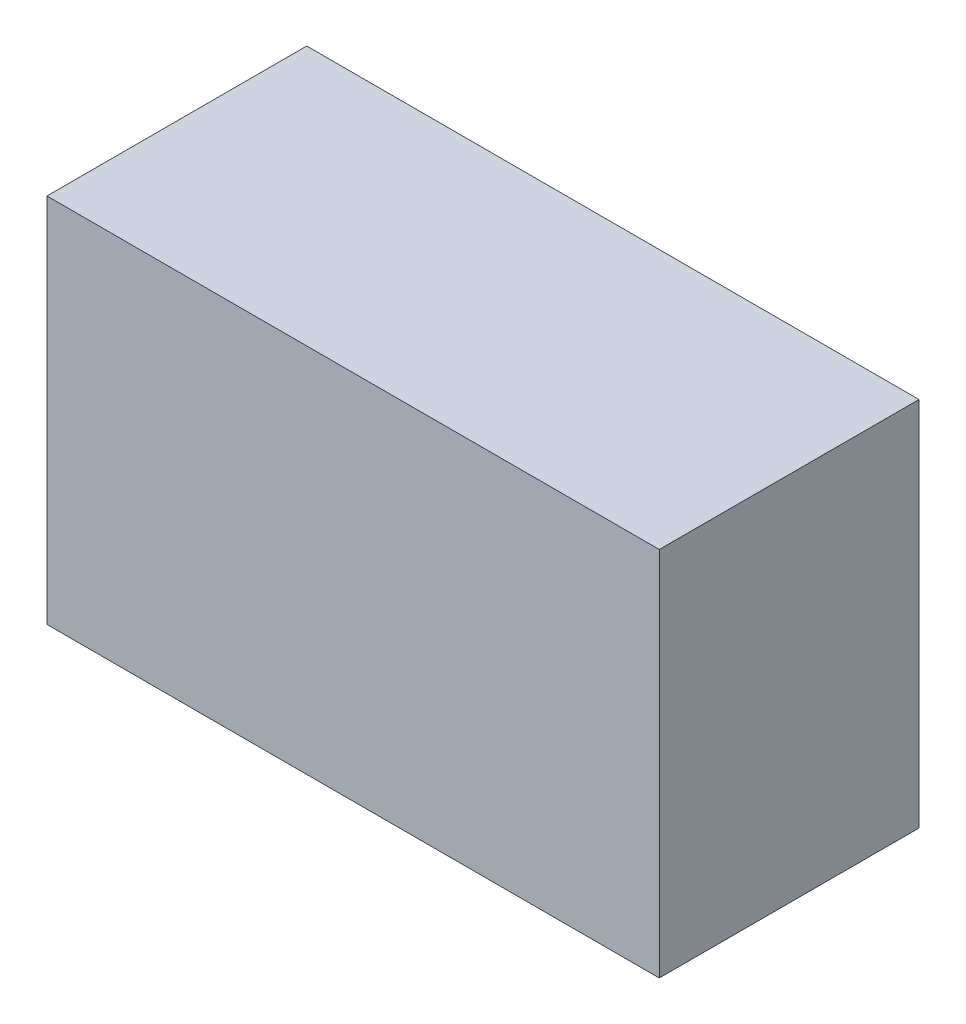
from build123d import *

# Parameters (mm, degrees)
SKETCH1_W           = 33
SKETCH1_H           = 20
BOSS_EXTRUDE1_DEPTH = 14


with BuildPart() as part:
    # Sketch1 → Boss-Extrude1 (new body)
    with BuildSketch(Plane.XY):
        Rectangle(SKETCH1_W, SKETCH1_H)
    extrude(amount=BOSS_EXTRUDE1_DEPTH)


solid = part.part
